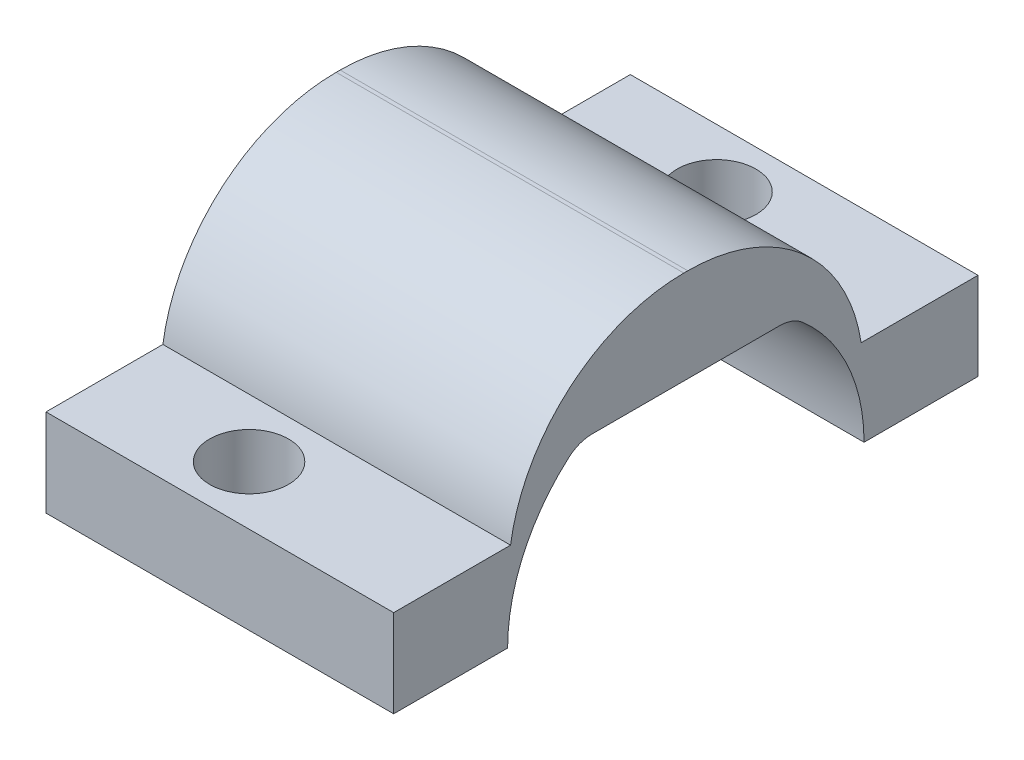
from build123d import *

# Parameters (mm, degrees)
RESSALTO_EXTRUS_O1_DEPTH   = 13.9
FILETE1_R                  = 6
CORTE_EXTRUS_O1_DEPTH      = 13.9
FILETE2_R                  = 1.2
CORTE_EXTRUS_O2_DEPTH      = 18.866728856
CORTE_EXTRUS_O2_DEPTH_BACK = 18.866728856
ESBO_O3_W                  = 2
ESBO_O3_H                  = 20.053518914


with BuildPart() as part:
    # Esboço1 → Ressalto-extrusão1 (new body)
    with BuildSketch(Plane(origin=(0, 0, 0), x_dir=(0, 0, -1), z_dir=(1, 0, 0))):
        with BuildLine():
            ThreePointArc((-3.633180425, 4.9), (-1.913112647, 5.792236183), (0, 6.1))
            ThreePointArc((0, 6.1), (1.913112647, 5.792236183), (3.633180425, 4.9))
            ThreePointArc((3.633180425, 4.9), (5.448504409, 2.742954557), (6.1, 0))
            Line((6.1, 0), (10, 0))
            Line((10, 0), (10, 3))
            Line((10, 3), (6, 3))
            Line((6, 3), (6, 8.1))
            Line((6, 8.1), (-6, 8.1))
            Line((-6, 8.1), (-6, 3))
            Line((-6, 3), (-10, 3))
            Line((-10, 3), (-10, 0))
            Line((-10, 0), (-6.1, 0))
            ThreePointArc((-6.1, 0), (-5.448504409, 2.742954557), (-3.633180425, 4.9))
        make_face()
        with BuildLine():
            ThreePointArc((3.633180425, 4.9), (1.913112647, 5.792236183), (0, 6.1))
            Line((0, 6.1), (0, 4.9))
            Line((0, 4.9), (3.633180425, 4.9))
        make_face()
        with BuildLine():
            Line((0, 4.9), (0, 6.1))
            ThreePointArc((0, 6.1), (-1.913112647, 5.792236183), (-3.633180425, 4.9))
            Line((-3.633180425, 4.9), (0, 4.9))
        make_face()
    extrude(amount=RESSALTO_EXTRUS_O1_DEPTH)

    # Filete1
    # the kernel refuses this fillet: 6 mm, written as the material it takes off along each edge
    with BuildSketch(Plane(origin=(-14.83028995, 8.1, 6), x_dir=(0, -1, 0), z_dir=(1, 0, 0))) as filete1_piece_1:
        with BuildLine():
            CenterArc((6, 5.93211598), FILETE1_R, 180, 81.373073441)
            Line((0, 5.93211598), (-0.12, 5.93211598))
            Line((-0.12, 5.93211598), (-0.12, 0))
            Line((-0.12, 0), (0, -0.12))
            ThreePointArc((0, -0.12), (2.55, -0.12), (5.082, -0.11864232))
            Line((5.082, -0.11864232), (5.1, 0))
        make_face()
    extrude(amount=43.5605799, mode=Mode.SUBTRACT)
    with BuildSketch(Plane(origin=(-14.83028995, 8.1, -6), x_dir=(0, -1, 0), z_dir=(1, 0, 0))) as filete1_piece_2:
        with BuildLine():
            CenterArc((6, -5.93211598), FILETE1_R, 98.626926559, 81.373073441)
            Line((0, -5.93211598), (-0.12, -5.93211598))
            Line((-0.12, -5.93211598), (-0.12, 0))
            Line((-0.12, 0), (0, 0.12))
            ThreePointArc((0, 0.12), (2.55, 0.12), (5.082, 0.11864232))
            Line((5.082, 0.11864232), (5.1, 0))
        make_face()
    extrude(amount=43.5605799, mode=Mode.SUBTRACT)

    # Esboço2 → Corte-extrusão1 (cut)
    with BuildSketch(Plane(origin=(0, 3, 0), x_dir=(1, 0, 0), z_dir=(0, 1, 0))):
        with BuildLine():
            ThreePointArc((6.95, 9.35), (5.6, 8), (6.95, 6.65))
            Line((6.95, 6.65), (6.95, 9.35))
        make_face()
        with BuildLine():
            Line((6.95, 9.35), (6.95, 6.65))
            ThreePointArc((6.95, 6.65), (7.904594155, 7.045405845), (8.3, 8))
            ThreePointArc((8.3, 8), (7.904594155, 8.954594155), (6.95, 9.35))
        make_face()
        with BuildLine():
            ThreePointArc((8.3, -8), (7.904594155, -7.045405845), (6.95, -6.65))
            Line((6.95, -6.65), (6.95, -9.35))
            ThreePointArc((6.95, -9.35), (7.904594155, -8.954594155), (8.3, -8))
        make_face()
        with BuildLine():
            Line((6.95, -9.35), (6.95, -6.65))
            ThreePointArc((6.95, -6.65), (5.6, -8), (6.95, -9.35))
        make_face()
    extrude(amount=-CORTE_EXTRUS_O1_DEPTH, mode=Mode.SUBTRACT)

    # Filete2
    filete2_edges = [part.edges().sort_by_distance(p)[0] for p in [
        (6.95, 4.9, -3.633180425),
        (6.95, 4.9, 3.633180425),
    ]]
    fillet(filete2_edges, radius=FILETE2_R)

    # Esboço3 → Corte-extrusão2 (cut, two sides: drawn at the far end of the back side and taken through both)
    with BuildSketch(Plane(origin=(0, 3, 0), x_dir=(1, 0, 0), z_dir=(0, 1, 0)).offset(-CORTE_EXTRUS_O2_DEPTH_BACK)):
        with Locations((1, -0.026759457)):
            Rectangle(ESBO_O3_W, ESBO_O3_H)
    extrude(amount=CORTE_EXTRUS_O2_DEPTH + CORTE_EXTRUS_O2_DEPTH_BACK, mode=Mode.SUBTRACT)


solid = part.part
